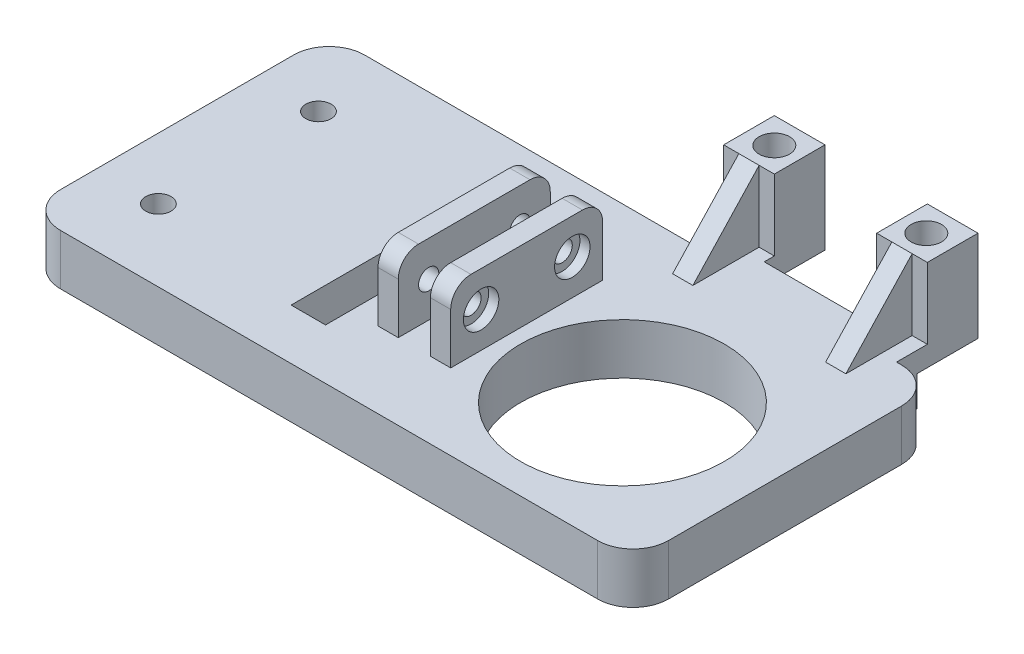
from build123d import *

# Parameters (mm, degrees)
SKETCH1_W           = 60
SKETCH1_H           = 30
BOSS_EXTRUDE1_DEPTH = 5
SKETCH2_R           = 1.25
SKETCH2_W           = 3.4
SKETCH2_H           = 20
CUT_EXTRUDE1_DEPTH  = 34.911649916
SKETCH3_R           = 10.05
CUT_EXTRUDE2_DEPTH  = 34.911649916
SKETCH4_W           = 20.1
SKETCH4_H           = 5
BOSS_EXTRUDE2_DEPTH = 8.04
SKETCH5_W           = 5
SKETCH5_H           = 5
SKETCH5_R           = 1.5
BOSS_EXTRUDE3_DEPTH = 7
SKETCH6_R           = 1.5
SKETCH6_W           = 10.1
SKETCH6_H           = 6
CUT_EXTRUDE3_DEPTH  = 5
RIB7_REACH          = 61.473
SKETCH8_WALL_W      = 130.526655278
SKETCH8_WALL_H      = 2
SKETCH9_W           = 5
SKETCH9_H           = 6
CUT_EXTRUDE4_DEPTH  = 3
SKETCH10_W          = 2
SKETCH10_H          = 15
BOSS_EXTRUDE4_DEPTH = 7
SKETCH11_R          = 1.75
CUT_EXTRUDE5_DEPTH  = 1
SKETCH12_R          = 1
CUT_EXTRUDE6_DEPTH  = 11
FILLET1_R           = 3.5
FILLET2_R           = 2


with BuildPart() as part:
    # Sketch1 → Boss-Extrude1 (new body)
    with BuildSketch(Plane(origin=(0, 0, 0), x_dir=(1, 0, 0), z_dir=(0, 1, 0))):
        Rectangle(SKETCH1_W, SKETCH1_H)
    extrude(amount=BOSS_EXTRUDE1_DEPTH)

    # Sketch2 → Cut-Extrude1 (cut, through all)
    with BuildSketch(Plane(origin=(0, 5, 0), x_dir=(1, 0, 0), z_dir=(0, 1, 0))):
        with Locations((-23.95, -7.9)):
            Circle(SKETCH2_R)
        with Locations((-23.95, 7.9)):
            Circle(SKETCH2_R)
        with Locations((-7.05, 0)):
            Rectangle(SKETCH2_W, SKETCH2_H)
    extrude(amount=-CUT_EXTRUDE1_DEPTH, mode=Mode.SUBTRACT)

    # Sketch3 → Cut-Extrude2 (cut, through all)
    with BuildSketch(Plane.XZ):
        with Locations((15.95, 2)):
            Circle(SKETCH3_R)
    extrude(amount=-CUT_EXTRUDE2_DEPTH, mode=Mode.SUBTRACT)

    # Sketch4 → Boss-Extrude2 (add)
    with BuildSketch(Plane(origin=(0, 0, -15), x_dir=(-1, 0, 0), z_dir=(0, 0, -1))):
        with Locations((-15.95, 2.5)):
            Rectangle(SKETCH4_W, SKETCH4_H)
    extrude(amount=BOSS_EXTRUDE2_DEPTH)

    # Sketch5 → Boss-Extrude3 (add)
    with BuildSketch(Plane(origin=(0, 5, 0), x_dir=(1, 0, 0), z_dir=(0, 1, 0))):
        with Locations((23.5, 20.54)):
            Rectangle(SKETCH5_W, SKETCH5_H)
        with Locations((23.45, 20.49)):
            Circle(SKETCH5_R, mode=Mode.SUBTRACT)
    boss_extrude3 = extrude(amount=BOSS_EXTRUDE3_DEPTH)

    # Sketch6 → Cut-Extrude3 (cut)
    with BuildSketch(Plane.XZ):
        with Locations((23.45, -20.49)):
            Circle(SKETCH6_R)
        with Locations((8.45, -20.49)):
            Circle(SKETCH6_R)
        with Locations((15.95, -20.04)):
            Rectangle(SKETCH6_W, SKETCH6_H)
    extrude(amount=-CUT_EXTRUDE3_DEPTH, mode=Mode.SUBTRACT)

    # Sketch8 wall → Rib7 (add, up to next)
    with BuildSketch(Plane(origin=(23.5, 8.5, -14.77), x_dir=(0, -0.730708043922, 0.68269008675), z_dir=(0, -0.68269008675, -0.730708043922)), mode=Mode.PRIVATE) as rib7_sk1:
        Rectangle(SKETCH8_WALL_W, SKETCH8_WALL_H)
    rib7_tool1 = extrude(rib7_sk1.sketch, amount=RIB7_REACH, mode=Mode.PRIVATE) - part.part
    rib7 = rib7_tool1.solids().sort_by_distance((23.5, 8.5, -14.77))[0]
    add(rib7)

    # Sketch9 → Cut-Extrude4 (cut)
    with BuildSketch(Plane.XZ):
        with Locations((23.5, -20.04)):
            Rectangle(SKETCH9_W, SKETCH9_H)
    cut_extrude4 = extrude(amount=-CUT_EXTRUDE4_DEPTH, mode=Mode.SUBTRACT)

    # Mirror1: Boss-Extrude3, Rib7, Cut-Extrude4 across plane
    add(boss_extrude3.mirror(Plane.ZY.offset(-15.95)))
    add(rib7.mirror(Plane.ZY.offset(-15.95)))
    add(cut_extrude4.mirror(Plane.ZY.offset(-15.95)), mode=Mode.SUBTRACT)

    # Sketch10 → Boss-Extrude4 (add)
    with BuildSketch(Plane(origin=(0, 5, 0), x_dir=(1, 0, 0), z_dir=(0, 1, 0))):
        with Locations((3.5, 0)):
            Rectangle(SKETCH10_W, SKETCH10_H)
        with Locations((-1.675, 0)):
            Rectangle(SKETCH10_W, SKETCH10_H)
    extrude(amount=BOSS_EXTRUDE4_DEPTH)

    # Sketch11 → Cut-Extrude5 (cut)
    with BuildSketch(Plane(origin=(4.5, 0, 0), x_dir=(0, 0, -1), z_dir=(1, 0, 0))):
        with Locations((4.5, 8.5)):
            Circle(SKETCH11_R)
        with Locations((-4.5, 8.5)):
            Circle(SKETCH11_R)
    extrude(amount=-CUT_EXTRUDE5_DEPTH, mode=Mode.SUBTRACT)

    # Sketch12 → Cut-Extrude6 (cut)
    with BuildSketch(Plane(origin=(3.5, 0, 0), x_dir=(0, 0, -1), z_dir=(1, 0, 0))):
        with Locations((-4.5, 8.5)):
            Circle(SKETCH12_R)
        with Locations((4.5, 8.5)):
            Circle(SKETCH12_R)
    extrude(amount=-CUT_EXTRUDE6_DEPTH, mode=Mode.SUBTRACT)

    # Fillet1
    fillet1_edges = [part.edges().sort_by_distance(p)[0] for p in [
        (-30, 2.5, 15),
        (-30, 2.5, -15),
        (30, 2.5, 15),
        (30, 2.5, -15),
    ]]
    fillet(fillet1_edges, radius=FILLET1_R)

    # Fillet2
    fillet2_edges = [part.edges().sort_by_distance(p)[0] for p in [
        (-1.675, 12, 7.5),
        (3.5, 12, 7.5),
        (-1.675, 12, -7.5),
        (3.5, 12, -7.5),
    ]]
    fillet(fillet2_edges, radius=FILLET2_R)


solid = part.part
